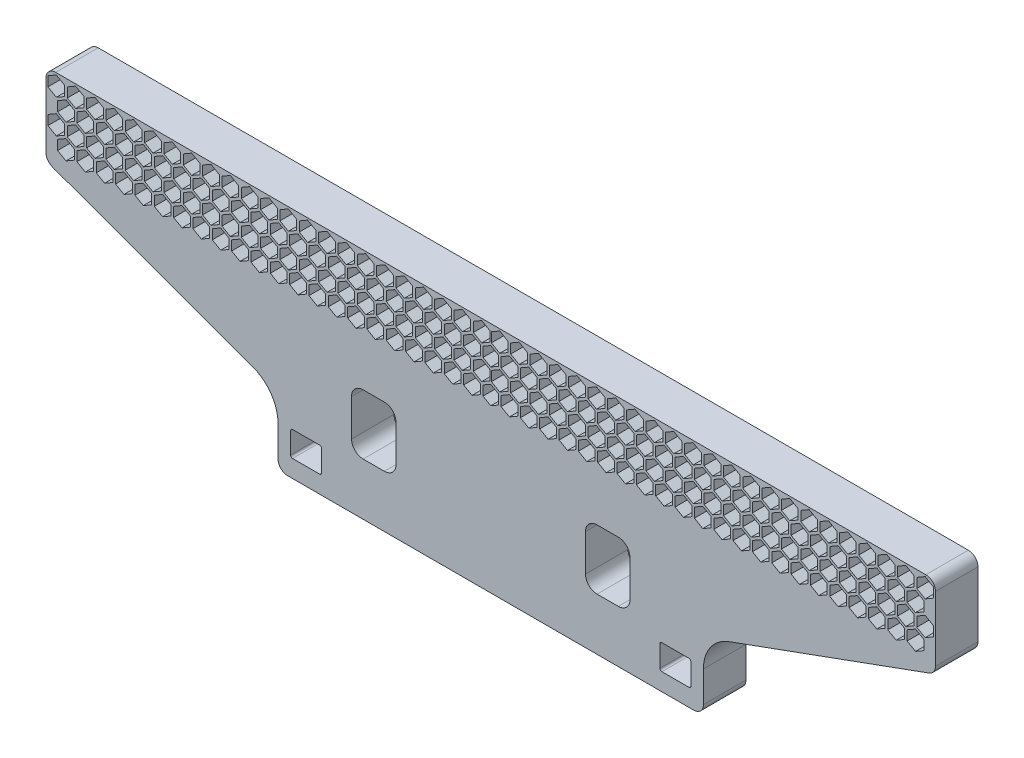
from build123d import *

# Parameters (mm, degrees)
SKETCH1_W           = 10.16
SKETCH1_H           = 8.255
BOSS_EXTRUDE1_DEPTH = 13.97
FILLET1_R           = 3.175
FILLET2_R           = 12.7
FILLET3_R           = 0.635


with BuildPart() as part:
    # Sketch1 → Boss-Extrude1 (new body)
    with BuildSketch(Plane.XY):
        Polygon((0, 38.314553574), (0, 32.059261944), (2.54, 30.59279226), (2.54, 27.41779226), (0, 25.951322577), (0, 21.04894796), (2.54, 19.582478277), (2.54, 16.407478277), (0, 14.941008593), (0, -38.314553574), (69.85, -38.314553574), (69.85, -16.089553574), (146.05, 11.644978277), (146.05, 38.314553574), align=None)
        Polygon((69.640369343, 32.18029226), (72.39, 30.59279226), (72.39, 27.41779226), (69.640369343, 25.83029226), (66.890738686, 27.41779226), (66.890738686, 30.59279226), align=None, mode=Mode.SUBTRACT)
        Polygon((69.640369343, 21.169978277), (72.39, 19.582478277), (72.39, 16.407478277), (69.640369343, 14.819978277), (66.890738686, 16.407478277), (66.890738686, 19.582478277), align=None, mode=Mode.SUBTRACT)
        with Locations((60.6425, -28.472053574)):
            Rectangle(SKETCH1_W, SKETCH1_H, mode=Mode.SUBTRACT)
        with BuildLine():
            ThreePointArc((45.72, -17.359553574), (44.604076836, -20.053630411), (41.91, -21.169553574))
            Line((41.91, -21.169553574), (34.925, -21.169553574))
            ThreePointArc((34.925, -21.169553574), (32.230923164, -20.053630411), (31.115, -17.359553574))
            Line((31.115, -17.359553574), (31.115, -5.294553574))
            ThreePointArc((31.115, -5.294553574), (32.230923164, -2.600476738), (34.925, -1.484553574))
            Line((34.925, -1.484553574), (41.91, -1.484553574))
            ThreePointArc((41.91, -1.484553574), (44.604076836, -2.600476738), (45.72, -5.294553574))
            Line((45.72, -5.294553574), (45.72, -17.359553574))
        make_face(mode=Mode.SUBTRACT)
        Polygon((8.89, 19.582478277), (8.89, 16.407478277), (6.140369343, 14.819978277), (3.390738686, 16.407478277), (3.390738686, 19.582478277), (6.140369343, 21.169978277), align=None, mode=Mode.SUBTRACT)
        Polygon((15.24, 19.582478277), (15.24, 16.407478277), (12.490369343, 14.819978277), (9.740738686, 16.407478277), (9.740738686, 19.582478277), (12.490369343, 21.169978277), align=None, mode=Mode.SUBTRACT)
        Polygon((21.59, 19.582478277), (21.59, 16.407478277), (18.840369343, 14.819978277), (16.090738686, 16.407478277), (16.090738686, 19.582478277), (18.840369343, 21.169978277), align=None, mode=Mode.SUBTRACT)
        Polygon((27.94, 19.582478277), (27.94, 16.407478277), (25.190369343, 14.819978277), (22.440738686, 16.407478277), (22.440738686, 19.582478277), (25.190369343, 21.169978277), align=None, mode=Mode.SUBTRACT)
        Polygon((34.29, 19.582478277), (34.29, 16.407478277), (31.540369343, 14.819978277), (28.790738686, 16.407478277), (28.790738686, 19.582478277), (31.540369343, 21.169978277), align=None, mode=Mode.SUBTRACT)
        Polygon((40.64, 19.582478277), (40.64, 16.407478277), (37.890369343, 14.819978277), (35.140738686, 16.407478277), (35.140738686, 19.582478277), (37.890369343, 21.169978277), align=None, mode=Mode.SUBTRACT)
        Polygon((0.215738686, 21.906739591), (0.215738686, 25.081739591), (2.965369343, 26.669239591), (5.715, 25.081739591), (5.715, 21.906739591), (2.965369343, 20.319239591), align=None, mode=Mode.SUBTRACT)
        Polygon((6.565738686, 21.906739591), (6.565738686, 25.081739591), (9.315369343, 26.669239591), (12.065, 25.081739591), (12.065, 21.906739591), (9.315369343, 20.319239591), align=None, mode=Mode.SUBTRACT)
        Polygon((12.915738686, 21.906739591), (12.915738686, 25.081739591), (15.665369343, 26.669239591), (18.415, 25.081739591), (18.415, 21.906739591), (15.665369343, 20.319239591), align=None, mode=Mode.SUBTRACT)
        Polygon((19.265738686, 21.906739591), (19.265738686, 25.081739591), (22.015369343, 26.669239591), (24.765, 25.081739591), (24.765, 21.906739591), (22.015369343, 20.319239591), align=None, mode=Mode.SUBTRACT)
        Polygon((25.615738686, 21.906739591), (25.615738686, 25.081739591), (28.365369343, 26.669239591), (31.115, 25.081739591), (31.115, 21.906739591), (28.365369343, 20.319239591), align=None, mode=Mode.SUBTRACT)
        Polygon((31.965738686, 21.906739591), (31.965738686, 25.081739591), (34.715369343, 26.669239591), (37.465, 25.081739591), (37.465, 21.906739591), (34.715369343, 20.319239591), align=None, mode=Mode.SUBTRACT)
        Polygon((8.89, 30.59279226), (8.89, 27.41779226), (6.140369343, 25.83029226), (3.390738686, 27.41779226), (3.390738686, 30.59279226), (6.140369343, 32.18029226), align=None, mode=Mode.SUBTRACT)
        Polygon((0.215738686, 32.917053574), (0.215738686, 36.092053574), (2.965369343, 37.679553574), (5.715, 36.092053574), (5.715, 32.917053574), (2.965369343, 31.329553574), align=None, mode=Mode.SUBTRACT)
        Polygon((6.565738686, 32.917053574), (6.565738686, 36.092053574), (9.315369343, 37.679553574), (12.065, 36.092053574), (12.065, 32.917053574), (9.315369343, 31.329553574), align=None, mode=Mode.SUBTRACT)
        Polygon((15.24, 30.59279226), (15.24, 27.41779226), (12.490369343, 25.83029226), (9.740738686, 27.41779226), (9.740738686, 30.59279226), (12.490369343, 32.18029226), align=None, mode=Mode.SUBTRACT)
        Polygon((21.59, 30.59279226), (21.59, 27.41779226), (18.840369343, 25.83029226), (16.090738686, 27.41779226), (16.090738686, 30.59279226), (18.840369343, 32.18029226), align=None, mode=Mode.SUBTRACT)
        Polygon((27.94, 30.59279226), (27.94, 27.41779226), (25.190369343, 25.83029226), (22.440738686, 27.41779226), (22.440738686, 30.59279226), (25.190369343, 32.18029226), align=None, mode=Mode.SUBTRACT)
        Polygon((34.29, 30.59279226), (34.29, 27.41779226), (31.540369343, 25.83029226), (28.790738686, 27.41779226), (28.790738686, 30.59279226), (31.540369343, 32.18029226), align=None, mode=Mode.SUBTRACT)
        Polygon((40.64, 30.59279226), (40.64, 27.41779226), (37.890369343, 25.83029226), (35.140738686, 27.41779226), (35.140738686, 30.59279226), (37.890369343, 32.18029226), align=None, mode=Mode.SUBTRACT)
        Polygon((12.915738686, 32.917053574), (12.915738686, 36.092053574), (15.665369343, 37.679553574), (18.415, 36.092053574), (18.415, 32.917053574), (15.665369343, 31.329553574), align=None, mode=Mode.SUBTRACT)
        Polygon((19.265738686, 32.917053574), (19.265738686, 36.092053574), (22.015369343, 37.679553574), (24.765, 36.092053574), (24.765, 32.917053574), (22.015369343, 31.329553574), align=None, mode=Mode.SUBTRACT)
        Polygon((25.615738686, 32.917053574), (25.615738686, 36.092053574), (28.365369343, 37.679553574), (31.115, 36.092053574), (31.115, 32.917053574), (28.365369343, 31.329553574), align=None, mode=Mode.SUBTRACT)
        Polygon((31.965738686, 32.917053574), (31.965738686, 36.092053574), (34.715369343, 37.679553574), (37.465, 36.092053574), (37.465, 32.917053574), (34.715369343, 31.329553574), align=None, mode=Mode.SUBTRACT)
        Polygon((46.99, 19.582478277), (46.99, 16.407478277), (44.240369343, 14.819978277), (41.490738686, 16.407478277), (41.490738686, 19.582478277), (44.240369343, 21.169978277), align=None, mode=Mode.SUBTRACT)
        Polygon((53.34, 19.582478277), (53.34, 16.407478277), (50.590369343, 14.819978277), (47.840738686, 16.407478277), (47.840738686, 19.582478277), (50.590369343, 21.169978277), align=None, mode=Mode.SUBTRACT)
        Polygon((59.69, 19.582478277), (59.69, 16.407478277), (56.940369343, 14.819978277), (54.190738686, 16.407478277), (54.190738686, 19.582478277), (56.940369343, 21.169978277), align=None, mode=Mode.SUBTRACT)
        Polygon((66.04, 19.582478277), (66.04, 16.407478277), (63.290369343, 14.819978277), (60.540738686, 16.407478277), (60.540738686, 19.582478277), (63.290369343, 21.169978277), align=None, mode=Mode.SUBTRACT)
        Polygon((38.315738686, 21.906739591), (38.315738686, 25.081739591), (41.065369343, 26.669239591), (43.815, 25.081739591), (43.815, 21.906739591), (41.065369343, 20.319239591), align=None, mode=Mode.SUBTRACT)
        Polygon((44.665738686, 21.906739591), (44.665738686, 25.081739591), (47.415369343, 26.669239591), (50.165, 25.081739591), (50.165, 21.906739591), (47.415369343, 20.319239591), align=None, mode=Mode.SUBTRACT)
        Polygon((51.015738686, 21.906739591), (51.015738686, 25.081739591), (53.765369343, 26.669239591), (56.515, 25.081739591), (56.515, 21.906739591), (53.765369343, 20.319239591), align=None, mode=Mode.SUBTRACT)
        Polygon((57.365738686, 21.906739591), (57.365738686, 25.081739591), (60.115369343, 26.669239591), (62.865, 25.081739591), (62.865, 21.906739591), (60.115369343, 20.319239591), align=None, mode=Mode.SUBTRACT)
        Polygon((63.715738686, 21.906739591), (63.715738686, 25.081739591), (66.465369343, 26.669239591), (69.215, 25.081739591), (69.215, 21.906739591), (66.465369343, 20.319239591), align=None, mode=Mode.SUBTRACT)
        Polygon((46.99, 30.59279226), (46.99, 27.41779226), (44.240369343, 25.83029226), (41.490738686, 27.41779226), (41.490738686, 30.59279226), (44.240369343, 32.18029226), align=None, mode=Mode.SUBTRACT)
        Polygon((53.34, 30.59279226), (53.34, 27.41779226), (50.590369343, 25.83029226), (47.840738686, 27.41779226), (47.840738686, 30.59279226), (50.590369343, 32.18029226), align=None, mode=Mode.SUBTRACT)
        Polygon((59.69, 30.59279226), (59.69, 27.41779226), (56.940369343, 25.83029226), (54.190738686, 27.41779226), (54.190738686, 30.59279226), (56.940369343, 32.18029226), align=None, mode=Mode.SUBTRACT)
        Polygon((66.04, 30.59279226), (66.04, 27.41779226), (63.290369343, 25.83029226), (60.540738686, 27.41779226), (60.540738686, 30.59279226), (63.290369343, 32.18029226), align=None, mode=Mode.SUBTRACT)
        Polygon((38.315738686, 32.917053574), (38.315738686, 36.092053574), (41.065369343, 37.679553574), (43.815, 36.092053574), (43.815, 32.917053574), (41.065369343, 31.329553574), align=None, mode=Mode.SUBTRACT)
        Polygon((44.665738686, 32.917053574), (44.665738686, 36.092053574), (47.415369343, 37.679553574), (50.165, 36.092053574), (50.165, 32.917053574), (47.415369343, 31.329553574), align=None, mode=Mode.SUBTRACT)
        Polygon((51.015738686, 32.917053574), (51.015738686, 36.092053574), (53.765369343, 37.679553574), (56.515, 36.092053574), (56.515, 32.917053574), (53.765369343, 31.329553574), align=None, mode=Mode.SUBTRACT)
        Polygon((57.365738686, 32.917053574), (57.365738686, 36.092053574), (60.115369343, 37.679553574), (62.865, 36.092053574), (62.865, 32.917053574), (60.115369343, 31.329553574), align=None, mode=Mode.SUBTRACT)
        Polygon((63.715738686, 32.917053574), (63.715738686, 36.092053574), (66.465369343, 37.679553574), (69.215, 36.092053574), (69.215, 32.917053574), (66.465369343, 31.329553574), align=None, mode=Mode.SUBTRACT)
        Polygon((145.415, 36.092053574), (145.415, 32.917053574), (142.665369343, 31.329553574), (139.915738686, 32.917053574), (139.915738686, 36.092053574), (142.665369343, 37.679553574), align=None, mode=Mode.SUBTRACT)
        Polygon((78.74, 19.582478277), (78.74, 16.407478277), (75.990369343, 14.819978277), (73.240738686, 16.407478277), (73.240738686, 19.582478277), (75.990369343, 21.169978277), align=None, mode=Mode.SUBTRACT)
        Polygon((85.09, 19.582478277), (85.09, 16.407478277), (82.340369343, 14.819978277), (79.590738686, 16.407478277), (79.590738686, 19.582478277), (82.340369343, 21.169978277), align=None, mode=Mode.SUBTRACT)
        Polygon((91.44, 19.582478277), (91.44, 16.407478277), (88.690369343, 14.819978277), (85.940738686, 16.407478277), (85.940738686, 19.582478277), (88.690369343, 21.169978277), align=None, mode=Mode.SUBTRACT)
        Polygon((97.79, 19.582478277), (97.79, 16.407478277), (95.040369343, 14.819978277), (92.290738686, 16.407478277), (92.290738686, 19.582478277), (95.040369343, 21.169978277), align=None, mode=Mode.SUBTRACT)
        Polygon((104.14, 19.582478277), (104.14, 16.407478277), (101.390369343, 14.819978277), (98.640738686, 16.407478277), (98.640738686, 19.582478277), (101.390369343, 21.169978277), align=None, mode=Mode.SUBTRACT)
        Polygon((110.49, 19.582478277), (110.49, 16.407478277), (107.740369343, 14.819978277), (104.990738686, 16.407478277), (104.990738686, 19.582478277), (107.740369343, 21.169978277), align=None, mode=Mode.SUBTRACT)
        Polygon((116.84, 19.582478277), (116.84, 16.407478277), (114.090369343, 14.819978277), (111.340738686, 16.407478277), (111.340738686, 19.582478277), (114.090369343, 21.169978277), align=None, mode=Mode.SUBTRACT)
        Polygon((123.19, 19.582478277), (123.19, 16.407478277), (120.440369343, 14.819978277), (117.690738686, 16.407478277), (117.690738686, 19.582478277), (120.440369343, 21.169978277), align=None, mode=Mode.SUBTRACT)
        Polygon((129.54, 19.582478277), (129.54, 16.407478277), (126.790369343, 14.819978277), (124.040738686, 16.407478277), (124.040738686, 19.582478277), (126.790369343, 21.169978277), align=None, mode=Mode.SUBTRACT)
        Polygon((135.89, 19.582478277), (135.89, 16.407478277), (133.140369343, 14.819978277), (130.390738686, 16.407478277), (130.390738686, 19.582478277), (133.140369343, 21.169978277), align=None, mode=Mode.SUBTRACT)
        Polygon((136.740738686, 16.407478277), (136.740738686, 19.582478277), (139.490369343, 21.169978277), (142.24, 19.582478277), (142.24, 16.407478277), (139.490369343, 14.819978277), align=None, mode=Mode.SUBTRACT)
        Polygon((70.065738686, 21.906739591), (70.065738686, 25.081739591), (72.815369343, 26.669239591), (75.565, 25.081739591), (75.565, 21.906739591), (72.815369343, 20.319239591), align=None, mode=Mode.SUBTRACT)
        Polygon((76.415738686, 21.906739591), (76.415738686, 25.081739591), (79.165369343, 26.669239591), (81.915, 25.081739591), (81.915, 21.906739591), (79.165369343, 20.319239591), align=None, mode=Mode.SUBTRACT)
        Polygon((82.765738686, 21.906739591), (82.765738686, 25.081739591), (85.515369343, 26.669239591), (88.265, 25.081739591), (88.265, 21.906739591), (85.515369343, 20.319239591), align=None, mode=Mode.SUBTRACT)
        Polygon((89.115738686, 21.906739591), (89.115738686, 25.081739591), (91.865369343, 26.669239591), (94.615, 25.081739591), (94.615, 21.906739591), (91.865369343, 20.319239591), align=None, mode=Mode.SUBTRACT)
        Polygon((78.74, 30.59279226), (78.74, 27.41779226), (75.990369343, 25.83029226), (73.240738686, 27.41779226), (73.240738686, 30.59279226), (75.990369343, 32.18029226), align=None, mode=Mode.SUBTRACT)
        Polygon((85.09, 30.59279226), (85.09, 27.41779226), (82.340369343, 25.83029226), (79.590738686, 27.41779226), (79.590738686, 30.59279226), (82.340369343, 32.18029226), align=None, mode=Mode.SUBTRACT)
        Polygon((91.44, 30.59279226), (91.44, 27.41779226), (88.690369343, 25.83029226), (85.940738686, 27.41779226), (85.940738686, 30.59279226), (88.690369343, 32.18029226), align=None, mode=Mode.SUBTRACT)
        Polygon((70.065738686, 32.917053574), (70.065738686, 36.092053574), (72.815369343, 37.679553574), (75.565, 36.092053574), (75.565, 32.917053574), (72.815369343, 31.329553574), align=None, mode=Mode.SUBTRACT)
        Polygon((76.415738686, 32.917053574), (76.415738686, 36.092053574), (79.165369343, 37.679553574), (81.915, 36.092053574), (81.915, 32.917053574), (79.165369343, 31.329553574), align=None, mode=Mode.SUBTRACT)
        Polygon((82.765738686, 32.917053574), (82.765738686, 36.092053574), (85.515369343, 37.679553574), (88.265, 36.092053574), (88.265, 32.917053574), (85.515369343, 31.329553574), align=None, mode=Mode.SUBTRACT)
        Polygon((89.115738686, 32.917053574), (89.115738686, 36.092053574), (91.865369343, 37.679553574), (94.615, 36.092053574), (94.615, 32.917053574), (91.865369343, 31.329553574), align=None, mode=Mode.SUBTRACT)
        Polygon((95.465738686, 21.906739591), (95.465738686, 25.081739591), (98.215369343, 26.669239591), (100.965, 25.081739591), (100.965, 21.906739591), (98.215369343, 20.319239591), align=None, mode=Mode.SUBTRACT)
        Polygon((101.815738686, 21.906739591), (101.815738686, 25.081739591), (104.565369343, 26.669239591), (107.315, 25.081739591), (107.315, 21.906739591), (104.565369343, 20.319239591), align=None, mode=Mode.SUBTRACT)
        Polygon((108.165738686, 21.906739591), (108.165738686, 25.081739591), (110.915369343, 26.669239591), (113.665, 25.081739591), (113.665, 21.906739591), (110.915369343, 20.319239591), align=None, mode=Mode.SUBTRACT)
        Polygon((114.515738686, 21.906739591), (114.515738686, 25.081739591), (117.265369343, 26.669239591), (120.015, 25.081739591), (120.015, 21.906739591), (117.265369343, 20.319239591), align=None, mode=Mode.SUBTRACT)
        Polygon((120.865738686, 21.906739591), (120.865738686, 25.081739591), (123.615369343, 26.669239591), (126.365, 25.081739591), (126.365, 21.906739591), (123.615369343, 20.319239591), align=None, mode=Mode.SUBTRACT)
        Polygon((127.215738686, 21.906739591), (127.215738686, 25.081739591), (129.965369343, 26.669239591), (132.715, 25.081739591), (132.715, 21.906739591), (129.965369343, 20.319239591), align=None, mode=Mode.SUBTRACT)
        Polygon((133.565738686, 21.906739591), (133.565738686, 25.081739591), (136.315369343, 26.669239591), (139.065, 25.081739591), (139.065, 21.906739591), (136.315369343, 20.319239591), align=None, mode=Mode.SUBTRACT)
        Polygon((139.915738686, 21.906739591), (139.915738686, 25.081739591), (142.665369343, 26.669239591), (145.415, 25.081739591), (145.415, 21.906739591), (142.665369343, 20.319239591), align=None, mode=Mode.SUBTRACT)
        Polygon((97.79, 30.59279226), (97.79, 27.41779226), (95.040369343, 25.83029226), (92.290738686, 27.41779226), (92.290738686, 30.59279226), (95.040369343, 32.18029226), align=None, mode=Mode.SUBTRACT)
        Polygon((104.14, 30.59279226), (104.14, 27.41779226), (101.390369343, 25.83029226), (98.640738686, 27.41779226), (98.640738686, 30.59279226), (101.390369343, 32.18029226), align=None, mode=Mode.SUBTRACT)
        Polygon((110.49, 30.59279226), (110.49, 27.41779226), (107.740369343, 25.83029226), (104.990738686, 27.41779226), (104.990738686, 30.59279226), (107.740369343, 32.18029226), align=None, mode=Mode.SUBTRACT)
        Polygon((116.84, 30.59279226), (116.84, 27.41779226), (114.090369343, 25.83029226), (111.340738686, 27.41779226), (111.340738686, 30.59279226), (114.090369343, 32.18029226), align=None, mode=Mode.SUBTRACT)
        Polygon((95.465738686, 32.917053574), (95.465738686, 36.092053574), (98.215369343, 37.679553574), (100.965, 36.092053574), (100.965, 32.917053574), (98.215369343, 31.329553574), align=None, mode=Mode.SUBTRACT)
        Polygon((101.815738686, 32.917053574), (101.815738686, 36.092053574), (104.565369343, 37.679553574), (107.315, 36.092053574), (107.315, 32.917053574), (104.565369343, 31.329553574), align=None, mode=Mode.SUBTRACT)
        Polygon((108.165738686, 32.917053574), (108.165738686, 36.092053574), (110.915369343, 37.679553574), (113.665, 36.092053574), (113.665, 32.917053574), (110.915369343, 31.329553574), align=None, mode=Mode.SUBTRACT)
        Polygon((114.515738686, 32.917053574), (114.515738686, 36.092053574), (117.265369343, 37.679553574), (120.015, 36.092053574), (120.015, 32.917053574), (117.265369343, 31.329553574), align=None, mode=Mode.SUBTRACT)
        Polygon((123.19, 30.59279226), (123.19, 27.41779226), (120.440369343, 25.83029226), (117.690738686, 27.41779226), (117.690738686, 30.59279226), (120.440369343, 32.18029226), align=None, mode=Mode.SUBTRACT)
        Polygon((129.54, 30.59279226), (129.54, 27.41779226), (126.790369343, 25.83029226), (124.040738686, 27.41779226), (124.040738686, 30.59279226), (126.790369343, 32.18029226), align=None, mode=Mode.SUBTRACT)
        Polygon((135.89, 30.59279226), (135.89, 27.41779226), (133.140369343, 25.83029226), (130.390738686, 27.41779226), (130.390738686, 30.59279226), (133.140369343, 32.18029226), align=None, mode=Mode.SUBTRACT)
        Polygon((136.740738686, 27.41779226), (136.740738686, 30.59279226), (139.490369343, 32.18029226), (142.24, 30.59279226), (142.24, 27.41779226), (139.490369343, 25.83029226), align=None, mode=Mode.SUBTRACT)
        Polygon((120.865738686, 32.917053574), (120.865738686, 36.092053574), (123.615369343, 37.679553574), (126.365, 36.092053574), (126.365, 32.917053574), (123.615369343, 31.329553574), align=None, mode=Mode.SUBTRACT)
        Polygon((127.215738686, 32.917053574), (127.215738686, 36.092053574), (129.965369343, 37.679553574), (132.715, 36.092053574), (132.715, 32.917053574), (129.965369343, 31.329553574), align=None, mode=Mode.SUBTRACT)
        Polygon((133.565738686, 32.917053574), (133.565738686, 36.092053574), (136.315369343, 37.679553574), (139.065, 36.092053574), (139.065, 32.917053574), (136.315369343, 31.329553574), align=None, mode=Mode.SUBTRACT)
    extrude(amount=BOSS_EXTRUDE1_DEPTH)

    # Fillet1
    fillet1_edges = [part.edges().sort_by_distance(p)[0] for p in [
        (69.85, -38.314553574, 6.985),
        (146.05, 11.644978277, 6.985),
        (146.05, 38.314553574, 6.985),
    ]]
    fillet(fillet1_edges, radius=FILLET1_R)

    # Fillet2
    fillet2_edges = [part.edges().sort_by_distance(p)[0] for p in [
        (69.85, -16.089553574, 6.985),
    ]]
    fillet(fillet2_edges, radius=FILLET2_R)

    # Fillet3
    fillet3_edges = [part.edges().sort_by_distance(p)[0] for p in [
        (65.7225, -32.599553574, 6.985),
        (55.5625, -32.599553574, 6.985),
        (65.7225, -24.344553574, 6.985),
        (55.5625, -24.344553574, 6.985),
    ]]
    fillet(fillet3_edges, radius=FILLET3_R)

    # Mirror1: part across plane


with BuildPart() as part_1:
    add(part.part)
    add(part.part.mirror(Plane(origin=(0, 0, 13.97), x_dir=(0, 0, 1), z_dir=(1, 0, 0))))


solid = part_1.part
